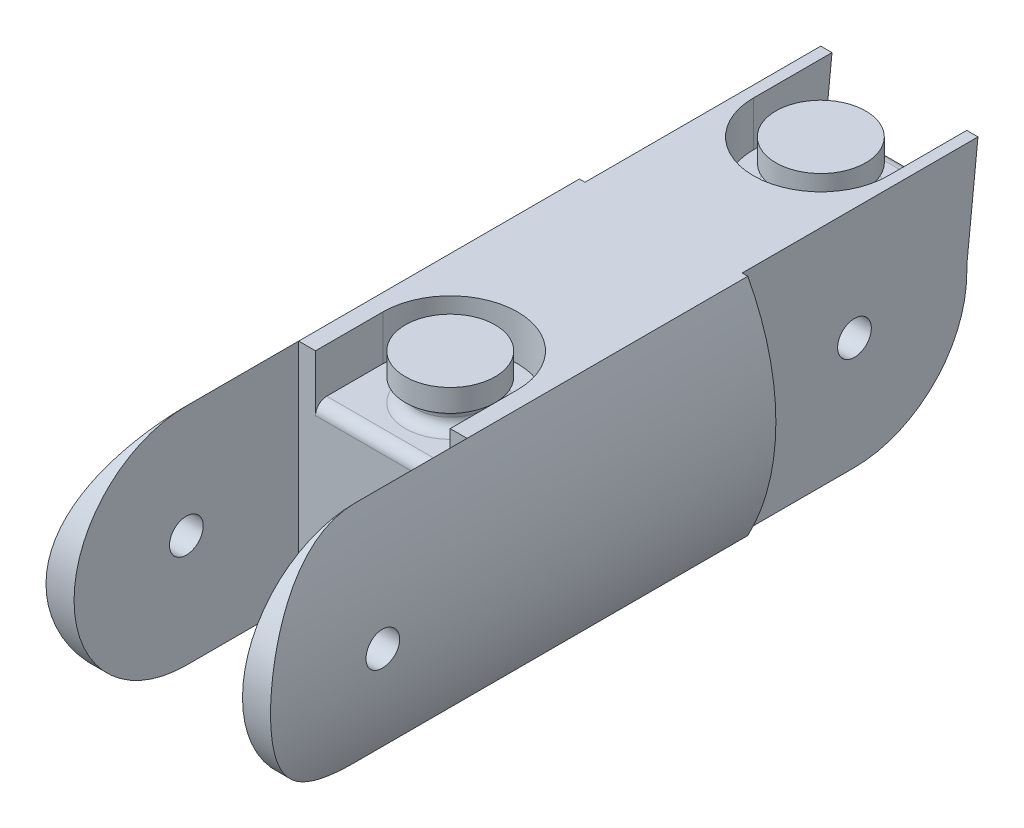
from build123d import *

# Parameters (mm, degrees)
SALIENTE_EXTRUIR2_DEPTH    = 45
CROQUIS4_R                 = 1.5
CORTAR_EXTRUIR1_DEPTH      = 50
SALIENTE_EXTRUIR3_DEPTH    = 20
CROQUIS8_R                 = 1.5
CORTAR_EXTRUIR4_DEPTH      = 14
REDONDEO1_R                = 10
CROQUIS6_W                 = 15
CROQUIS6_H                 = 20
CORTAR_EXTRUIR2_DEPTH      = 20
CORTAR_EXTRUIR3_DEPTH      = 48.16990566
CORTAR_EXTRUIR3_DEPTH_BACK = 48.16990566
CROQUIS7_R                 = 1.5
CUT_EXTRUDE1_DEPTH         = 4
SKETCH2_R                  = 3
BOSS_EXTRUDE1_DEPTH        = 2
SKETCH3_R                  = 4
BOSS_EXTRUDE2_DEPTH        = 2
FILLET2_R                  = 1
FILLET3_R                  = 1
FILLET4_R                  = 1
BOSS_EXTRUDE3_DEPTH        = 1
BOSS_EXTRUDE4_DEPTH        = 1


with BuildPart() as part:
    # Croquis2 → Saliente-Extruir2 (new body)
    with BuildSketch(Plane.XY):
        with BuildLine():
            Line((-7.5, -10), (7.5, -10))
            ThreePointArc((7.5, -10), (10, 0), (7.5, 10))
            Line((7.5, 10), (-7.5, 10))
            ThreePointArc((-7.5, 10), (-10, 0), (-7.5, -10))
        make_face()
    extrude(amount=SALIENTE_EXTRUIR2_DEPTH)

    # Croquis4 → Cortar-Extruir1 (cut)
    with BuildSketch(Plane(origin=(0, 0, 0), x_dir=(-1, 0, 0), z_dir=(0, 0, -1))):
        with Locations((0, -7)):
            Circle(CROQUIS4_R)
    extrude(amount=-CORTAR_EXTRUIR1_DEPTH, mode=Mode.SUBTRACT)

    # Croquis3 → Saliente-Extruir3 (add)
    with BuildSketch(Plane(origin=(0, 0, 0), x_dir=(-1, 0, 0), z_dir=(0, 0, -1))):
        Polygon((7, 10), (7, -10), (3, -10), (3, -3), (-3, -3), (-3, -10), (-7, -10), (-7, 10), align=None)
    extrude(amount=SALIENTE_EXTRUIR3_DEPTH)

    # Croquis8 → Cortar-Extruir4 (cut)
    with BuildSketch(Plane.ZY.offset(7)):
        with Locations((-10, 0)):
            Circle(CROQUIS8_R)
    extrude(amount=-CORTAR_EXTRUIR4_DEPTH, mode=Mode.SUBTRACT)

    # Redondeo1
    redondeo1_edges = [part.edges().sort_by_distance(p)[0] for p in [
        (5, -10, -20),
    ]]
    fillet(redondeo1_edges, radius=REDONDEO1_R)

    # Croquis6 → Cortar-Extruir2 (cut)
    with BuildSketch(Plane.XY.offset(45)):
        Rectangle(CROQUIS6_W, CROQUIS6_H)
    extrude(amount=-CORTAR_EXTRUIR2_DEPTH, mode=Mode.SUBTRACT)

    # Croquis7 → Cortar-Extruir3 (cut, two sides: drawn at the far end of the back side and taken through both)
    with BuildSketch(Plane(origin=(0, 0, 0), x_dir=(0, 0, -1), z_dir=(1, 0, 0)).offset(-CORTAR_EXTRUIR3_DEPTH_BACK)):
        with Locations((-35, 0)):
            Circle(CROQUIS7_R)
        with BuildLine():
            Line((-35, -10), (-50, -10))
            Line((-50, -10), (-50, 10))
            Line((-50, 10), (-35, 10))
            ThreePointArc((-35, 10), (-45, 0), (-35, -10))
        make_face()
    extrude(amount=CORTAR_EXTRUIR3_DEPTH + CORTAR_EXTRUIR3_DEPTH_BACK, mode=Mode.SUBTRACT)

    # Sketch1 → Cut-Extrude1 (cut)
    with BuildSketch(Plane(origin=(0, 10, 0), x_dir=(1, 0, 0), z_dir=(0, 1, 0))):
        with BuildLine():
            Line((-6, 14), (-6, 20))
            Line((-6, 20), (6, 20))
            Line((6, 20), (6, 14))
            ThreePointArc((6, 14), (0, 8), (-6, 14))
        make_face()
        with BuildLine():
            Line((-6, -19), (-6, -25))
            Line((-6, -25), (6, -25))
            Line((6, -25), (6, -19))
            ThreePointArc((6, -19), (0, -13), (-6, -19))
        make_face()
    extrude(amount=-CUT_EXTRUDE1_DEPTH, mode=Mode.SUBTRACT)

    # Sketch2 → Boss-Extrude1 (add)
    with BuildSketch(Plane(origin=(0, 6, 0), x_dir=(1, 0, 0), z_dir=(0, 1, 0))):
        with Locations(Location((0, -19, 0), (0, 0, 270))):
            Circle(SKETCH2_R)
        with Locations(Location((0, 14, 0), (0, 0, 270))):
            Circle(SKETCH2_R)
    extrude(amount=BOSS_EXTRUDE1_DEPTH)

    # Sketch3 → Boss-Extrude2 (add)
    with BuildSketch(Plane(origin=(0, 8, 0), x_dir=(1, 0, 0), z_dir=(0, 1, 0))):
        with Locations(Location((0, -19, 0), (0, 0, 270))):
            Circle(SKETCH3_R)
        with Locations(Location((0, 14, 0), (0, 0, 270))):
            Circle(SKETCH3_R)
    extrude(amount=BOSS_EXTRUDE2_DEPTH)

    # Fillet2
    fillet2_edges = [part.edges().sort_by_distance(p)[0] for p in [
        (0, 6, 16),
        (0, 8, 16),
        (0, 6, -17),
        (0, 8, -17),
    ]]
    fillet(fillet2_edges, radius=FILLET2_R - 0.0001)  # a hair under: the kernel refuses the full size

    # Fillet3
    fillet3_edges = [part.edges().sort_by_distance(p)[0] for p in [
        (0, 6, -20),
        (0, 6, 25),
    ]]
    fillet(fillet3_edges, radius=FILLET3_R)

    # Fillet4
    fillet4_edges = [part.edges().sort_by_distance(p)[0] for p in [
        (1.5, -7, 0),
        (1.5, -7, 25),
    ]]
    fillet(fillet4_edges, radius=FILLET4_R)

    # Sketch5 → Boss-Extrude3 (add)
    with BuildSketch(Plane.ZY.offset(7)):
        Polygon((-20, 10), (-21, 10), (-19.670225284, -2.546908511), align=None)
    extrude(amount=-BOSS_EXTRUDE3_DEPTH)

    # Sketch4 → Boss-Extrude4 (add)
    with BuildSketch(Plane(origin=(7, 0, 0), x_dir=(0, 0, -1), z_dir=(1, 0, 0))):
        Polygon((20, 10), (21, 10), (19.670225284, -2.546908511), align=None)
    extrude(amount=-BOSS_EXTRUDE4_DEPTH)


solid = part.part
